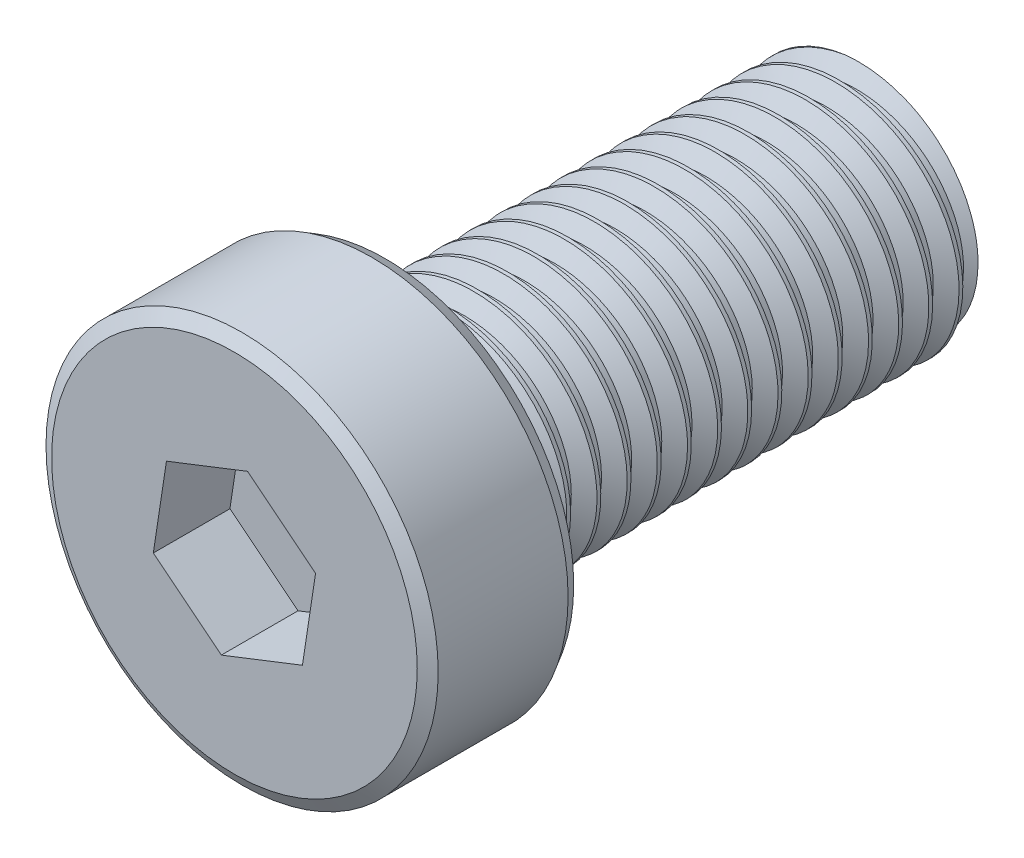
from build123d import *
from OCP.BRepFilletAPI import BRepFilletAPI_MakeChamfer

# Parameters (mm, degrees)
SKETCH1_R           = 6.5
BOSS_EXTRUDE1_DEPTH = 5
CUT_EXTRUDE1_DEPTH  = 2.54
SKETCH3_R           = 4
BOSS_EXTRUDE2_DEPTH = 16
CHAMFER1_SIZE       = 0.254
CHAMFER1_SIZE2      = 0.439940905
THREAD1_PITCH       = 1


with BuildPart() as part:
    # Sketch1 → Boss-Extrude1 (new body)
    with BuildSketch(Plane.XY):
        Circle(SKETCH1_R)
    extrude(amount=BOSS_EXTRUDE1_DEPTH)

    # Sketch2 → Cut-Extrude1 (cut)
    with BuildSketch(Plane.XY.offset(5)):
        Polygon((2.254658513, -1.802733569), (2.688542324, 1.051224765), (0.43388381, 2.853958334), (-2.254658513, 1.802733569), (-2.688542324, -1.051224765), (-0.43388381, -2.853958334), align=None)
    extrude(amount=-CUT_EXTRUDE1_DEPTH, mode=Mode.SUBTRACT)

    # Sketch3 → Boss-Extrude2 (add)
    with BuildSketch(Plane(origin=(0, 0, 0), x_dir=(-1, 0, 0), z_dir=(0, 0, -1))):
        with Locations(Location((0, 0, 0), (0, 0, 180))):
            Circle(SKETCH3_R)
    extrude(amount=BOSS_EXTRUDE2_DEPTH)

    # Chamfer1: one chamfer whose edges measure the first distance from different faces: ONE call of the kernel's chamfer builder (chamfer() names one face for all edges)
    chamfer1_edges_1 = [part.edges().sort_by_distance(p)[0] for p in [
        (-6.5, 0, 0),
    ]]
    chamfer1_side_1 = [part.faces().sort_by_distance(p)[0] for p in [
        (-6.316152237, 0, 0),
    ]]
    chamfer1_edges_2 = [part.edges().sort_by_distance(p)[0] for p in [
        (-4, 0, -16),
    ]]
    chamfer1_side_2 = [part.faces().sort_by_distance(p)[0] for p in [
        (-4, 0, -8),
    ]]
    chamfer1_edges_3 = [part.edges().sort_by_distance(p)[0] for p in [
        (-6.5, 0, 5),
    ]]
    chamfer1_side_3 = [part.faces().sort_by_distance(p)[0] for p in [
        (-6.5, 0, 2.5),
    ]]
    chamfer1 = BRepFilletAPI_MakeChamfer(part.part.solid().wrapped)
    for e in chamfer1_edges_1:
        chamfer1.Add(CHAMFER1_SIZE, CHAMFER1_SIZE2, e.wrapped, chamfer1_side_1[0].wrapped)  # the first distance lies on this face
    for e in chamfer1_edges_2:
        chamfer1.Add(CHAMFER1_SIZE, CHAMFER1_SIZE2, e.wrapped, chamfer1_side_2[0].wrapped)  # the first distance lies on this face
    for e in chamfer1_edges_3:
        chamfer1.Add(CHAMFER1_SIZE, CHAMFER1_SIZE2, e.wrapped, chamfer1_side_3[0].wrapped)  # the first distance lies on this face
    add(Compound.cast(chamfer1.Shape()), mode=Mode.REPLACE)

    # Thread1: arcs per turn and ends read off the stored shape
    # Thread1: the profile of Thread Profile1 profile screwed along a right-hand helix through 17.27 turns, 8 arcs to a turn; built about Z, then put on its axis
    thread1_z = Axis((0, 0, 0), (0, 0, 1))
    thread1_corners = [(4.0003, 0, -0.000173205), (4.0003, 0, 0.875173202), (3.458734125, 0, 0.562499999), (3.458734125, 0, 0.312499999)]
    with BuildLine(mode=Mode.PRIVATE) as thread1_profile:
        Line(thread1_corners[0], thread1_corners[1])
        Line(thread1_corners[1], thread1_corners[2])
        Line(thread1_corners[2], thread1_corners[3])
        Line(thread1_corners[3], thread1_corners[0])
    thread1_cap = Face(thread1_profile.wire())
    thread1_turn_angles = [0, 22.5, 45, 67.5, 90, 112.5, 135, 157.5, 180, 202.5, 225, 247.5, 270, 292.5, 315, 337.5, 360]
    thread1_turn_weights = [1, 0.9238795325112867, 1, 0.9238795325112867, 1, 0.9238795325112867, 1, 0.9238795325112867, 1, 0.9238795325112867, 1, 0.9238795325112867, 1, 0.9238795325112867, 1, 0.9238795325112867, 1]
    thread1_turn_rails = [Edge.make_bspline([Vector(p[0], p[1], 0).rotate(thread1_z, thread1_turn_angles[k]) / thread1_turn_weights[k] + Vector(0, 0, p[2] + THREAD1_PITCH * thread1_turn_angles[k] / 360) for k in range(17)], [0, 0, 0, 1, 1, 2, 2, 3, 3, 4, 4, 5, 5, 6, 6, 7, 7, 8, 8, 8], 2, thread1_turn_weights) for p in thread1_corners]
    thread1_turn_sides = [Face.make_surface_from_curves(thread1_turn_rails[p[0]], thread1_turn_rails[p[1]]) for p in [(0, 1), (1, 2), (2, 3), (3, 0)]]
    thread1_last_angles = [6120, 6142.5, 6165, 6187.5, 6210, 6213.6, 6217.2]
    thread1_last_weights = [1, 0.9238795325112867, 1, 0.9238795325112867, 1, 0.9980267284282717, 1]
    thread1_last_rails = [Edge.make_bspline([Vector(p[0], p[1], 0).rotate(thread1_z, thread1_last_angles[k]) / thread1_last_weights[k] + Vector(0, 0, p[2] + THREAD1_PITCH * thread1_last_angles[k] / 360) for k in range(7)], [0, 0, 0, 1, 1, 2, 2, 3, 3, 3], 2, thread1_last_weights) for p in thread1_corners]
    thread1_last_sides = [Face.make_surface_from_curves(thread1_last_rails[p[0]], thread1_last_rails[p[1]]) for p in [(0, 1), (1, 2), (2, 3), (3, 0)]]
    thread1 = Plane(origin=(0, 0, -17.016), x_dir=(1, 0, 0), z_dir=(0, 0, 1)) * Solid(Shell([*[p.moved(Location((0, 0, THREAD1_PITCH * i))) for i in range(17) for p in thread1_turn_sides], *thread1_last_sides, thread1_cap, thread1_cap.rotate(thread1_z, 6217.2).moved(Location((0, 0, THREAD1_PITCH * 6217.2 / 360)))]))
    add(thread1, mode=Mode.SUBTRACT)


solid = part.part
